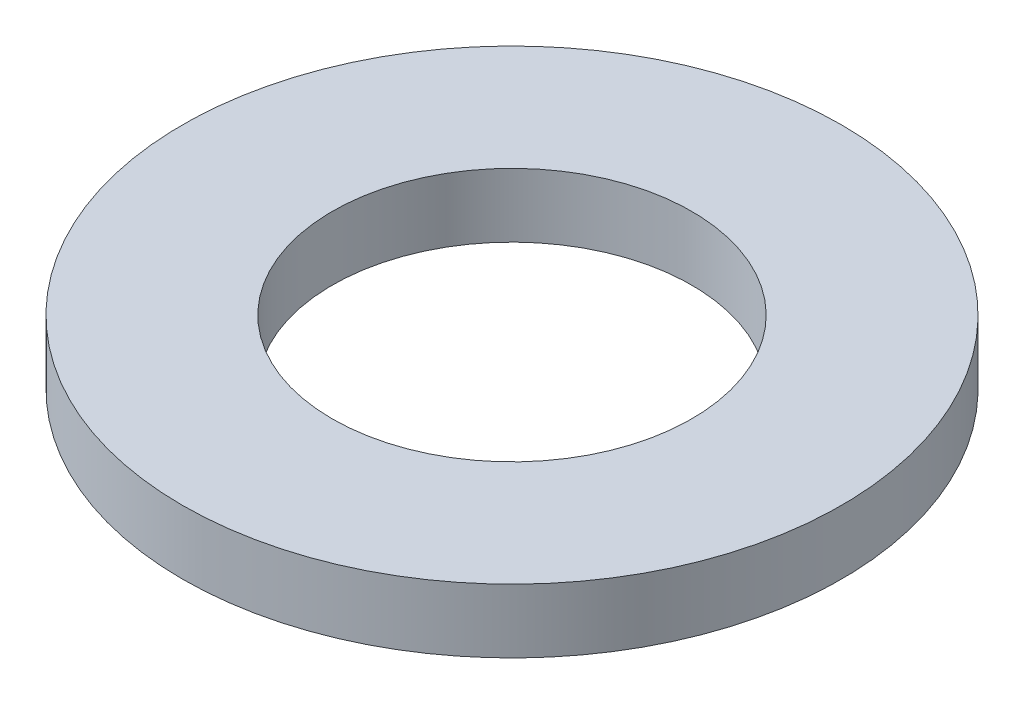
from build123d import *

# Parameters (mm, degrees)
SKETCH1_R           = 82.5
BOSS_EXTRUDE1_DEPTH = 16
SKETCH2_R           = 45
CUT_EXTRUDE1_DEPTH  = 118.764595698


with BuildPart() as part:
    # Sketch1 → Boss-Extrude1 (new body)
    with BuildSketch(Plane(origin=(0, 0, 0), x_dir=(1, 0, 0), z_dir=(0, 1, 0))):
        Circle(SKETCH1_R)
    extrude(amount=BOSS_EXTRUDE1_DEPTH)

    # Sketch2 → Cut-Extrude1 (cut, through all)
    with BuildSketch(Plane(origin=(0, 0, 0), x_dir=(1, 0, 0), z_dir=(0, 1, 0))):
        Circle(SKETCH2_R)
    extrude(amount=CUT_EXTRUDE1_DEPTH, mode=Mode.SUBTRACT)


solid = part.part
